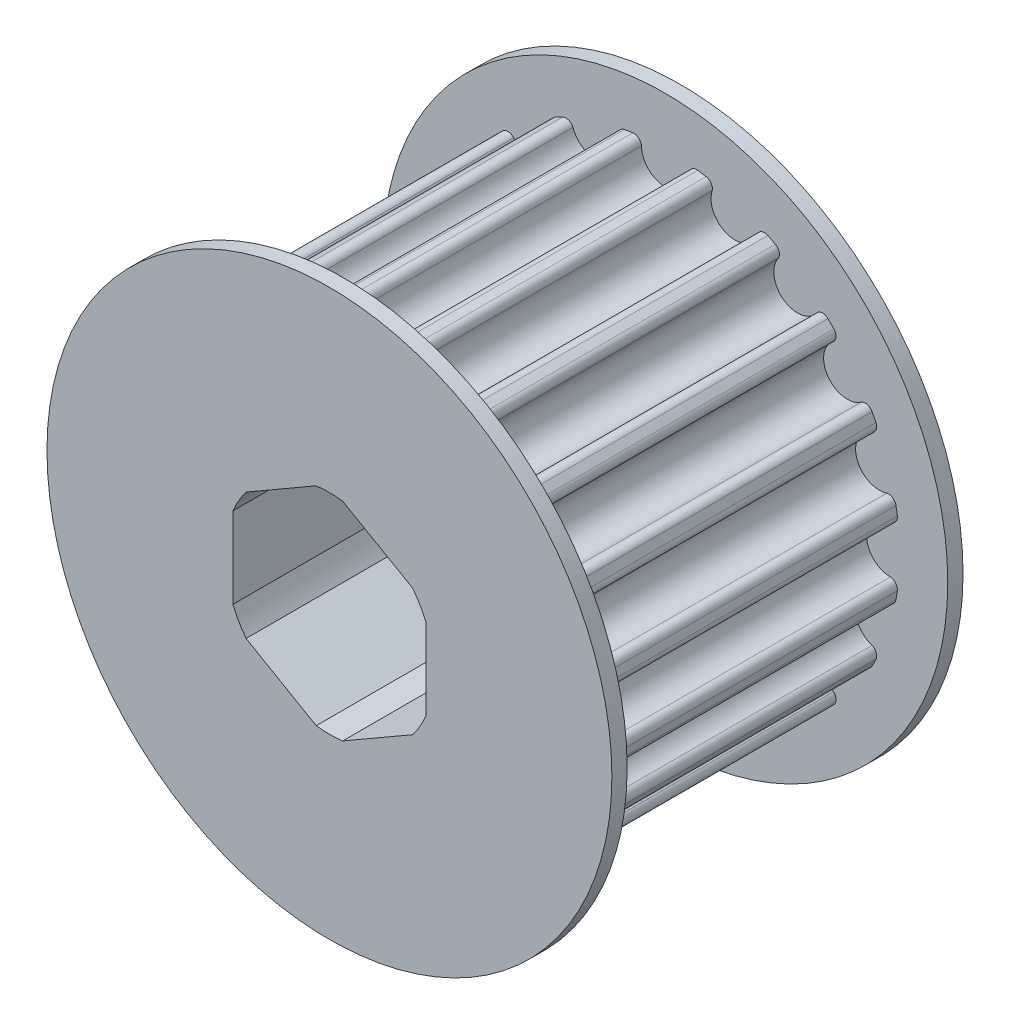
from build123d import *

# Parameters (mm, degrees)
SKETCH2_R                = 15.343994309
BOSS_EXTRUDE1_DEPTH      = 21
CUT_EXTRUDE1_DEPTH       = 31.19728999
FILLET1_R                = 0.5
CIRPATTERN1_COUNT        = 20
FILLET1_OF_CIRPATTERN1_R = 0.5
CUT_EXTRUDE2_DEPTH       = 31.051908029
SKETCH7_R                = 18.5
BOSS_EXTRUDE2_DEPTH      = 1


with BuildPart() as part:
    # Sketch2 → Boss-Extrude1 (new body)
    with BuildSketch(Plane.XY):
        Circle(SKETCH2_R)
    extrude(amount=BOSS_EXTRUDE1_DEPTH)

    # Sketch3 → Cut-Extrude1 (cut, through all)
    with BuildSketch(Plane(origin=(0, 0, 0), x_dir=(-1, 0, 0), z_dir=(0, 0, -1))):
        with BuildLine():
            Line((-1.614471729, 15.258821789), (-1.56, 14.743994309))
            ThreePointArc((-1.56, 14.743994309), (0, 13.183994309), (1.56, 14.743994309))
            Line((1.56, 14.743994309), (1.614471729, 15.258821789))
            ThreePointArc((1.614471729, 15.258821789), (0, 15.343994309), (-1.614471729, 15.258821789))
        make_face()
    cut_extrude1 = extrude(amount=-CUT_EXTRUDE1_DEPTH, mode=Mode.SUBTRACT)

    # Fillet1
    fillet1_edges = [part.edges().sort_by_distance(p)[0] for p in [
        (-1.614471729, 15.258821789, 10.5),
        (1.614471729, 15.258821789, 10.5),
    ]]
    fillet(fillet1_edges, radius=FILLET1_R)

    # CirPattern1: Cut-Extrude1 ×20 about axis
    cirpattern1_axis = Axis((0, 0, 0), (0, 0, 1))
    for i in range(1, CIRPATTERN1_COUNT):
        add(cut_extrude1.rotate(cirpattern1_axis, i * 360 / CIRPATTERN1_COUNT), mode=Mode.SUBTRACT)

    # Fillet1 of CirPattern1
    fillet1_of_cirpattern1_edges = [part.edges().sort_by_distance(p)[0] for p in [
        (-6.250689106, 14.013102692, 10.5),
        (-3.179781388, 15.010901095, 10.5),
        (-10.275045481, 11.395683469, 10.5),
        (-7.662775349, 13.293608814, 10.5),
        (-13.293608814, 7.662775349, 10.5),
        (-11.395683469, 10.275045481, 10.5),
        (-15.010901095, 3.179781388, 10.5),
        (-14.013102692, 6.250689106, 10.5),
        (-15.258821789, -1.614471729, 10.5),
        (-15.258821789, 1.614471729, 10.5),
        (-14.013102692, -6.250689106, 10.5),
        (-15.010901095, -3.179781388, 10.5),
        (-11.395683469, -10.275045481, 10.5),
        (-13.293608814, -7.662775349, 10.5),
        (-7.662775349, -13.293608814, 10.5),
        (-10.275045481, -11.395683469, 10.5),
        (-3.179781388, -15.010901095, 10.5),
        (-6.250689106, -14.013102692, 10.5),
        (1.614471729, -15.258821789, 10.5),
        (-1.614471729, -15.258821789, 10.5),
        (6.250689106, -14.013102692, 10.5),
        (3.179781388, -15.010901095, 10.5),
        (10.275045481, -11.395683469, 10.5),
        (7.662775349, -13.293608814, 10.5),
        (13.293608814, -7.662775349, 10.5),
        (11.395683469, -10.275045481, 10.5),
        (15.010901095, -3.179781388, 10.5),
        (14.013102692, -6.250689106, 10.5),
        (15.258821789, 1.614471729, 10.5),
        (15.258821789, -1.614471729, 10.5),
        (14.013102692, 6.250689106, 10.5),
        (15.010901095, 3.179781388, 10.5),
        (11.395683469, 10.275045481, 10.5),
        (13.293608814, 7.662775349, 10.5),
        (7.662775349, 13.293608814, 10.5),
        (10.275045481, 11.395683469, 10.5),
        (3.179781388, 15.010901095, 10.5),
        (6.250689106, 14.013102692, 10.5),
    ]]
    fillet(fillet1_of_cirpattern1_edges, radius=FILLET1_OF_CIRPATTERN1_R)

    # Sketch5 → Cut-Extrude2 (cut, through all)
    with BuildSketch(Plane(origin=(0, 0, 0), x_dir=(-1, 0, 0), z_dir=(0, 0, -1))):
        with BuildLine():
            ThreePointArc((-0.865846402, -6.803122372), (0, -6.858), (0.865846402, -6.803122372))
            Line((0.865846402, -6.803122372), (5.458753598, -4.151406166))
            ThreePointArc((5.458753598, -4.151406166), (5.939202219, -3.429), (6.3246, -2.651716207))
            Line((6.3246, -2.651716207), (6.3246, 2.651716207))
            ThreePointArc((6.3246, 2.651716207), (5.939202219, 3.429), (5.458753598, 4.151406166))
            Line((5.458753598, 4.151406166), (0.865846402, 6.803122372))
            ThreePointArc((0.865846402, 6.803122372), (0, 6.858), (-0.865846402, 6.803122372))
            Line((-0.865846402, 6.803122372), (-5.458753598, 4.151406166))
            ThreePointArc((-5.458753598, 4.151406166), (-5.939202219, 3.429), (-6.3246, 2.651716207))
            Line((-6.3246, 2.651716207), (-6.3246, -2.651716207))
            ThreePointArc((-6.3246, -2.651716207), (-5.939202219, -3.429), (-5.458753598, -4.151406166))
            Line((-5.458753598, -4.151406166), (-0.865846402, -6.803122372))
        make_face()
    extrude(amount=-CUT_EXTRUDE2_DEPTH, mode=Mode.SUBTRACT)

    # Sketch7 → Boss-Extrude2 (add)
    with BuildSketch(Plane.XY.offset(21)):
        Circle(SKETCH7_R)
        with BuildLine():
            Line((6.3246, -2.651716207), (6.3246, 2.651716207))
            ThreePointArc((6.3246, 2.651716207), (5.939202219, 3.429), (5.458753598, 4.151406166))
            Line((5.458753598, 4.151406166), (0.865846402, 6.803122372))
            ThreePointArc((0.865846402, 6.803122372), (0, 6.858), (-0.865846402, 6.803122372))
            Line((-0.865846402, 6.803122372), (-5.458753598, 4.151406166))
            ThreePointArc((-5.458753598, 4.151406166), (-5.939202219, 3.429), (-6.3246, 2.651716207))
            Line((-6.3246, 2.651716207), (-6.3246, -2.651716207))
            ThreePointArc((-6.3246, -2.651716207), (-5.939202219, -3.429), (-5.458753598, -4.151406166))
            Line((-5.458753598, -4.151406166), (-0.865846402, -6.803122372))
            ThreePointArc((-0.865846402, -6.803122372), (0, -6.858), (0.865846402, -6.803122372))
            Line((0.865846402, -6.803122372), (5.458753598, -4.151406166))
            ThreePointArc((5.458753598, -4.151406166), (5.939202219, -3.429), (6.3246, -2.651716207))
        make_face(mode=Mode.SUBTRACT)
    boss_extrude2 = extrude(amount=BOSS_EXTRUDE2_DEPTH)

    # Mirror1: Boss-Extrude2 across plane
    add(boss_extrude2.mirror(Plane.XY.offset(10.5)))


solid = part.part
